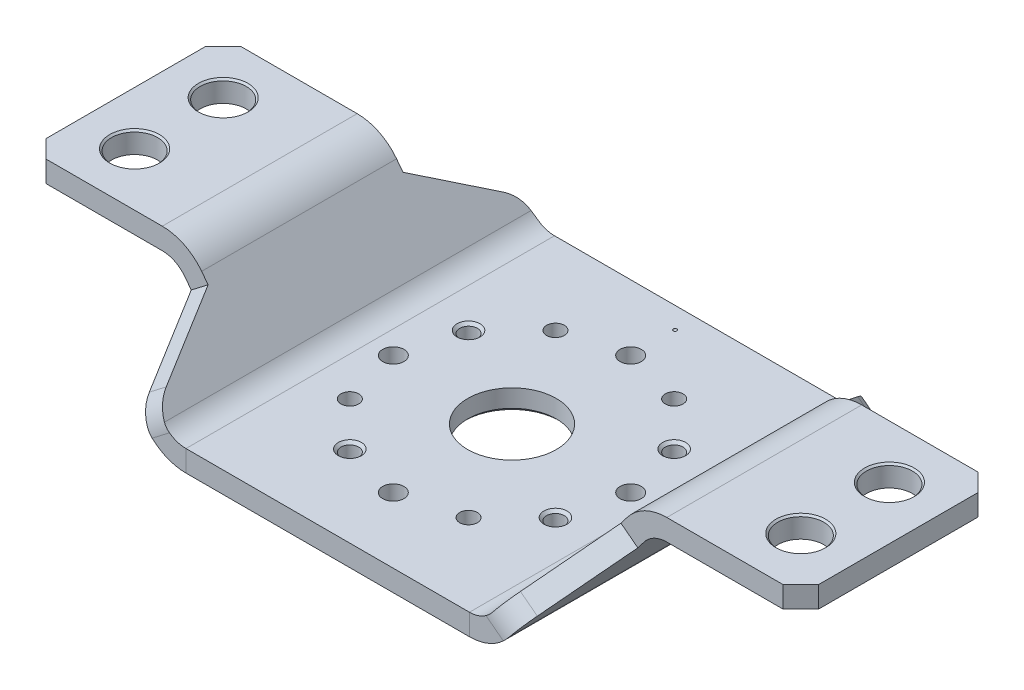
from build123d import *

# Parameters (mm, degrees)
SKETCH_1_W             = 109
SKETCH_1_H             = 104
SM_BASE_FLANGE_1_DEPTH = 6
OTHER_START            = -52
OTHER_1_DEPTH          = 104
OTHER_1_2_DEPTH        = 104
CUT_EXTRUDE_1_DEPTH    = 108.693293005
CUT_EXTRUDE_2_REACH    = 127.065
SKETCH_8_R             = 6.5
CHAMFER_1_SIZE         = 0.5
CHAMFER_2_SIZE         = 5
FILLET_1_R             = 10
M6X1_01_D              = 5
M6X1_01_CSINK_D        = 6.5
M6X1_01_CSINK_ANGLE    = 90
M6X1_02_AT_2_COUNT     = 2
M6X1_02_AT_2_PITCH     = 47.376154339
M6X1_02_AT_3_COUNT     = 2
M6X1_02_AT_3_PITCH     = 47.376154339
M6X1_02_AT_4_COUNT     = 2
M6X1_02_AT_4_PITCH     = 64.717030361
SKETCH_9_R             = 12.5
SKETCH_9_R_2           = 3
CUT_EXTRUDE_3_DEPTH    = 6
CHAMFER_3_SIZE         = 1


# Read off the part's stored shape, not the designer's step: Изгиб1
# Sheet-metal steps are written as plain solids
with BuildPart() as part:
    # Sketch 1 → Базовая кромка1 (new body)
    with BuildSketch(Plane(origin=(0, 0, 0), x_dir=(1, 0, 0), z_dir=(0, 1, 0))):
        with Locations((54.5, 0)):
            Rectangle(SKETCH_1_W, SKETCH_1_H)
    extrude(amount=-SM_BASE_FLANGE_1_DEPTH)

    # Other 1 outline → Other 1 (cut)
    with BuildSketch(Plane.XY.offset(OTHER_START)):
        with BuildLine():
            Line((109, 0), (51.507997892, 0))
            Line((51.507997892, 0), (51.106946786, -0.522660023))
            ThreePointArc((51.106946786, -0.522660023), (46.192041675, -4.556218407), (40, -6.000000028))
            Line((40, -6.000000028), (109, -6))
            Line((109, -6), (109, 0))
        make_face()
    extrude(amount=OTHER_1_DEPTH, mode=Mode.SUBTRACT)

    # Other 1 2 outline → Other 1 2 (add)
    with BuildSketch(Plane.XY.offset(OTHER_START)):
        with BuildLine():
            ThreePointArc((71.183364554, 26.500000037), (64.991322874, 25.056218415), (60.07641776, 21.022660029))
            Line((60.07641776, 21.022660029), (46.346826745, 3.129908551))
            ThreePointArc((46.346826745, 3.129908551), (43.538309534, 0.825018043), (40, -2.8e-08))
            Line((40, -2.8e-08), (51.507997892, 0))
            Line((51.507997892, 0), (64.836537802, 17.370091455))
            ThreePointArc((64.836537802, 17.370091455), (67.645055016, 19.674981966), (71.183364554, 20.500000037))
            Line((71.183364554, 20.500000037), (109, 20.5))
            Line((109, 20.5), (109, 26.5))
            Line((109, 26.5), (71.183364554, 26.500000037))
        make_face()
    extrude(amount=OTHER_1_2_DEPTH)

    # Эскиз5 → Вытянуть1 (cut, through all)
    with BuildSketch(Plane(origin=(27.659504319, -21.223884138, 0), x_dir=(0.608761429008719, 0.7933533402912364, 0), z_dir=(-0.7933533402912364, 0.608761429008719, 0))):
        Polygon((33.697283883, 52), (50.250603481, 27.5), (53.250603481, 27.5), (87.37885928, 27.5), (87.37885928, 52), align=None)
        Polygon((87.37885928, -52), (33.697283883, -52), (50.250603481, -27.5), (53.250603481, -27.5), (87.37885928, -27.5), align=None)
    extrude(amount=-CUT_EXTRUDE_1_DEPTH, mode=Mode.SUBTRACT)

    # Эскиз8 → Вытянуть2 (cut, up to next)
    with BuildSketch(Plane(origin=(0, 26.5, 0), x_dir=(1, 0, 0), z_dir=(0, 1, 0)), mode=Mode.PRIVATE) as cut_extrude_2_sk1:
        with Locations(Location((94, 12.5, 0), (0, 0, 270))):
            Circle(SKETCH_8_R)
    cut_extrude_2_tool1 = extrude(cut_extrude_2_sk1.sketch, amount=-CUT_EXTRUDE_2_REACH, mode=Mode.PRIVATE) & part.part
    # Эскиз8 → Вытянуть2 (cut, up to next)
    with BuildSketch(Plane(origin=(0, 26.5, 0), x_dir=(1, 0, 0), z_dir=(0, 1, 0)), mode=Mode.PRIVATE) as cut_extrude_2_sk2:
        with Locations(Location((94, -12.5, 0), (0, 0, 270))):
            Circle(SKETCH_8_R)
    cut_extrude_2_tool2 = extrude(cut_extrude_2_sk2.sketch, amount=-CUT_EXTRUDE_2_REACH, mode=Mode.PRIVATE) & part.part
    add(cut_extrude_2_tool1.solids().sort_by_distance((94, 26.5, -12.5))[0], mode=Mode.SUBTRACT)
    add(cut_extrude_2_tool2.solids().sort_by_distance((94, 26.5, 12.5))[0], mode=Mode.SUBTRACT)

    # Фаска1
    chamfer_1_edges = [part.edges().sort_by_distance(p)[0] for p in [
        (94, 26.5, -19),
        (94, 26.5, 6),
    ]]
    chamfer(chamfer_1_edges, length=CHAMFER_1_SIZE)

    # Фаска2
    chamfer_2_edges = [part.edges().sort_by_distance(p)[0] for p in [
        (109, 23.5, -27.5),
        (109, 23.5, 27.5),
    ]]
    chamfer(chamfer_2_edges, length=CHAMFER_2_SIZE)

    # Скругление1
    fillet_1_edges = [part.edges().sort_by_distance(p)[0] for p in [
        (50.553171029, 3.683684303, -52),
        (50.553171029, 3.683684303, 52),
    ]]
    fillet(fillet_1_edges, radius=FILLET_1_R)

    # Зеркальное отражение1: part across plane


with BuildPart() as part_1:
    add(part.part)
    add(part.part.mirror(Plane(origin=(0, -6, -52), x_dir=(0, 0, 1), z_dir=(-1, 0, 0))))

    # Отверстие обработанное метчиком M6x1.01 (through all)
    with Locations(Plane(origin=(29.011851027, 0, 16.75), x_dir=(0, 0, 1), z_dir=(0, 1, 0))):
        with Locations((0, 0), (12.261851027, -45.761851027), (-33.5, -58.023702054), (-33.5, 0)):
            CounterSinkHole(M6X1_01_D / 2, M6X1_01_CSINK_D / 2, counter_sink_angle=M6X1_01_CSINK_ANGLE)

    # Эскиз11 → Отверстие обработанное метчиком M6x1.02 (revolve, cut)
    with BuildSketch(Plane(origin=(-29.011851027, 0, 16.75), x_dir=(0, 0, 1), z_dir=(1, 0, 0))):
        Polygon((0, 0), (0, 6.000000028), (3.25, 6.000000028), (2.5, 5.250000028), (2.5, 0), align=None)
    m6x1_02 = revolve(axis=Axis((-29.011851027, 6.35, 16.75), (0, -1, 0)), mode=Mode.SUBTRACT)

    # Отверстие обработанное метчиком M6x1.02 at 2: Отверстие обработанное метчиком M6x1.02 ×2
    with Locations(*[Vector(0.9659258262890683, 0, 0.2588190451025209) * (i * M6X1_02_AT_2_PITCH) for i in range(1, M6X1_02_AT_2_COUNT)]):
        add(m6x1_02, mode=Mode.SUBTRACT)

    # Отверстие обработанное метчиком M6x1.02 at 3: Отверстие обработанное метчиком M6x1.02 ×2
    with Locations(*[Vector(0.25881904510252063, 0, -0.9659258262890683) * (i * M6X1_02_AT_3_PITCH) for i in range(1, M6X1_02_AT_3_COUNT)]):
        add(m6x1_02, mode=Mode.SUBTRACT)

    # Отверстие обработанное метчиком M6x1.02 at 4: Отверстие обработанное метчиком M6x1.02 ×2
    with Locations(*[Vector(0.7071067811865474, 0, -0.7071067811865478) * (i * M6X1_02_AT_4_PITCH) for i in range(1, M6X1_02_AT_4_COUNT)]):
        add(m6x1_02, mode=Mode.SUBTRACT)

    # Эскиз9 → Вытянуть3 (cut)
    with BuildSketch(Plane(origin=(0, 0, 0), x_dir=(1, 0, 0), z_dir=(0, 1, 0))):
        with Locations(Location((0, 0, 0), (0, 0, 270))):
            Circle(SKETCH_9_R)
        with Locations(Location((0, 33.5, 0), (0, 0, 270))):
            Circle(SKETCH_9_R_2)
        with Locations(Location((0, -33.5, 0), (0, 0, 270))):
            Circle(SKETCH_9_R_2)
        with Locations(Location((-33.5, 0, 0), (0, 0, 270))):
            Circle(SKETCH_9_R_2)
        with Locations(Location((33.5, 0, 0), (0, 0, 270))):
            Circle(SKETCH_9_R_2)
    extrude(amount=-CUT_EXTRUDE_3_DEPTH, mode=Mode.SUBTRACT)

    # Фаска3
    chamfer_3_edges = [part_1.edges().sort_by_distance(p)[0] for p in [
        (0, -6, -12.5),
    ]]
    chamfer(chamfer_3_edges, length=CHAMFER_3_SIZE)

    # Эскиз12 → Вырез-Повернуть1 (revolve, cut)
    with BuildSketch(Plane(origin=(0, 0, 0), x_dir=(1, 0, 0), z_dir=(0, 1, 0))):
        with BuildLine():
            Line((0, 46.5), (0, 45.5))
            ThreePointArc((0, 45.5), (0.5, 46), (0, 46.5))
        make_face()
    revolve(axis=Axis((0, 0, -52), (0, 0, 1)), mode=Mode.SUBTRACT)


solid = part_1.part
